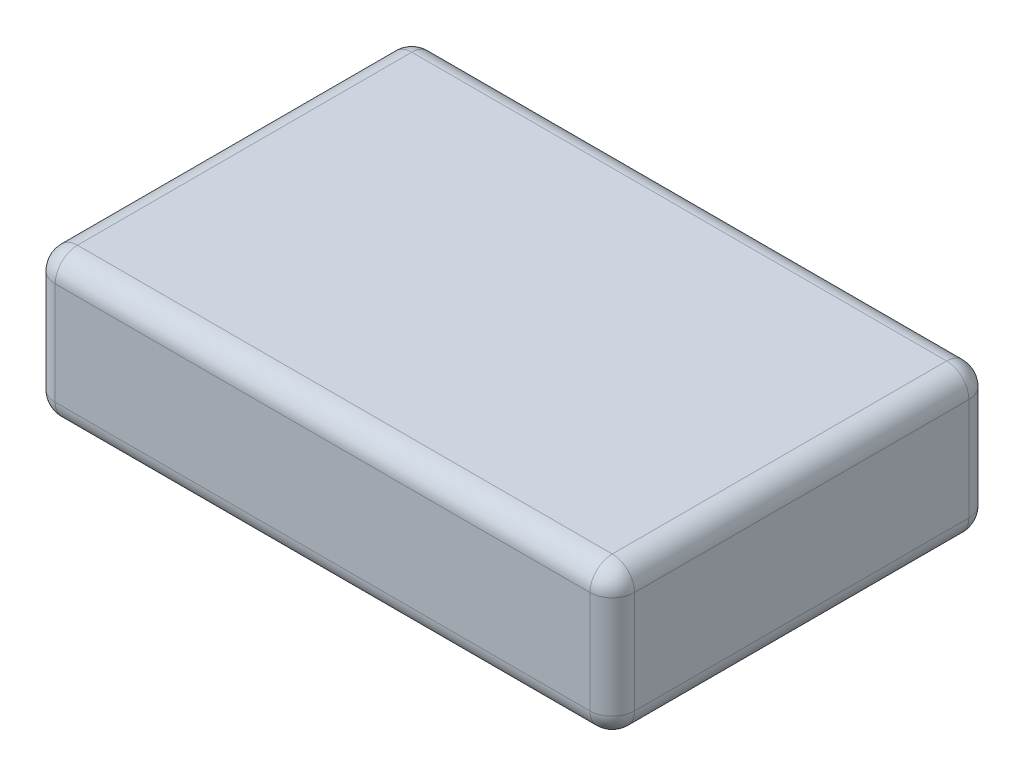
from build123d import *

# Parameters (mm, degrees)
SKETCH1_W           = 26
SKETCH1_H           = 17
BOSS_EXTRUDE1_DEPTH = 6.6
FILLET1_R           = 1


with BuildPart() as part:
    # Sketch1 → Boss-Extrude1 (new body)
    with BuildSketch(Plane(origin=(0, 0, 0), x_dir=(1, 0, 0), z_dir=(0, 1, 0))):
        Rectangle(SKETCH1_W, SKETCH1_H)
    extrude(amount=BOSS_EXTRUDE1_DEPTH)

    # Fillet1
    fillet1_edges = [part.edges().sort_by_distance(p)[0] for p in [
        (-13, 3.3, -8.5),
        (-13, 3.3, 8.5),
        (13, 3.3, 8.5),
        (13, 3.3, -8.5),
        (0, 0, -8.5),
        (-13, 0, 0),
        (0, 0, 8.5),
        (13, 0, 0),
        (0, 6.6, 8.5),
        (-13, 6.6, 0),
        (0, 6.6, -8.5),
        (13, 6.6, 0),
    ]]
    fillet(fillet1_edges, radius=FILLET1_R)


solid = part.part
